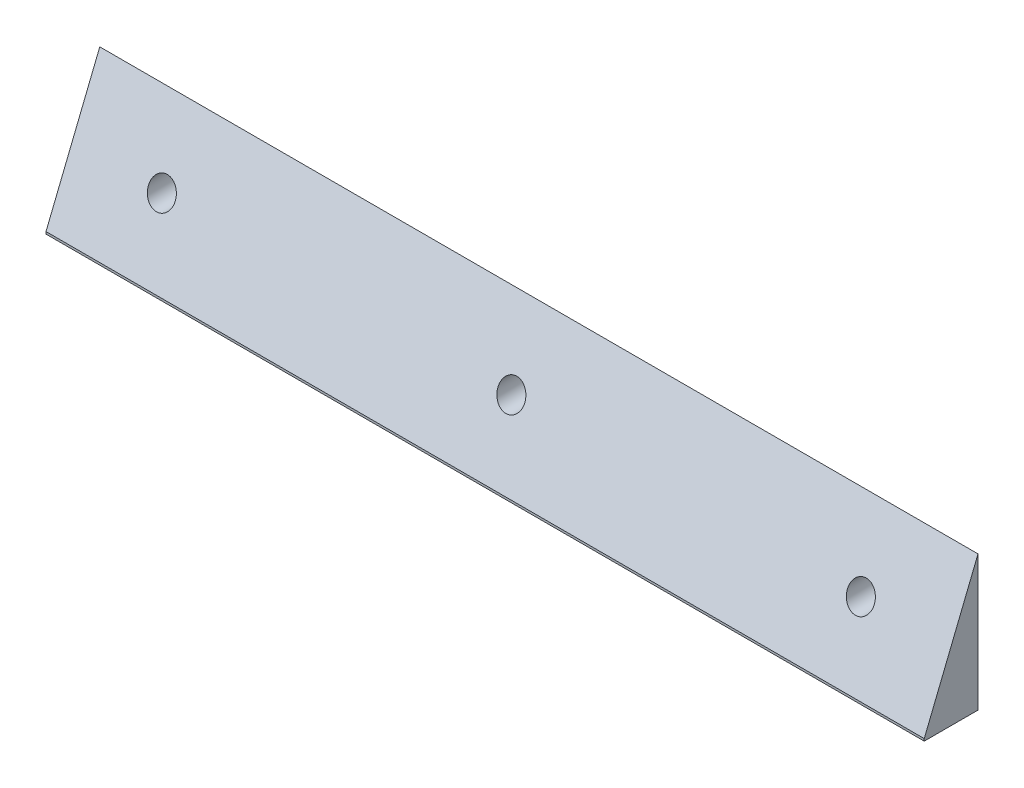
from build123d import *

# Parameters (mm, degrees)
ESBO_O1_W                = 98
ESBO_O1_H                = 25
RESSALTO_EXTRUS_O1_DEPTH = 6
CHANFRO1_SIZE            = 10
CHANFRO1_SIZE_2          = 24.750868534
ESBO_O3_R                = 1.5
CORTE_EXTRUS_O1_DEPTH    = 6


with BuildPart() as part:
    # Esboço1 → Ressalto-extrusão1 (new body)
    with BuildSketch(Plane.XY):
        with Locations((49, -12.5)):
            Rectangle(ESBO_O1_W, ESBO_O1_H)
    extrude(amount=RESSALTO_EXTRUS_O1_DEPTH)

    # Chanfro1
    # the kernel refuses this chamfer: 24.750868534, 10 mm, written as the material it takes off along each edge
    with BuildSketch(Plane(origin=(-64.178729721, 0, 6), x_dir=(0, 0.0881670647319357, -0.9961057015681392), z_dir=(1, 0, 0))) as chanfro1_piece_1:
        Polygon((CHANFRO1_SIZE * 0.996105701568, -CHANFRO1_SIZE * 0.0881670647319), (-CHANFRO1_SIZE_2 * 0.0881670647325, -CHANFRO1_SIZE_2 * 0.996105701575), (0, 0), align=None)
    extrude(amount=226.357459443, mode=Mode.SUBTRACT)

    # Esboço3 → Corte-extrusão1 (cut)
    with BuildSketch(Plane(origin=(0, 0, 0), x_dir=(-1, 0, 0), z_dir=(0, 0, -1))):
        with Locations((-49, -17.5)):
            Circle(ESBO_O3_R)
        with Locations((-10, -17.5)):
            Circle(ESBO_O3_R)
        with Locations((-88, -17.5)):
            Circle(ESBO_O3_R)
    extrude(amount=-CORTE_EXTRUS_O1_DEPTH, mode=Mode.SUBTRACT)


solid = part.part
